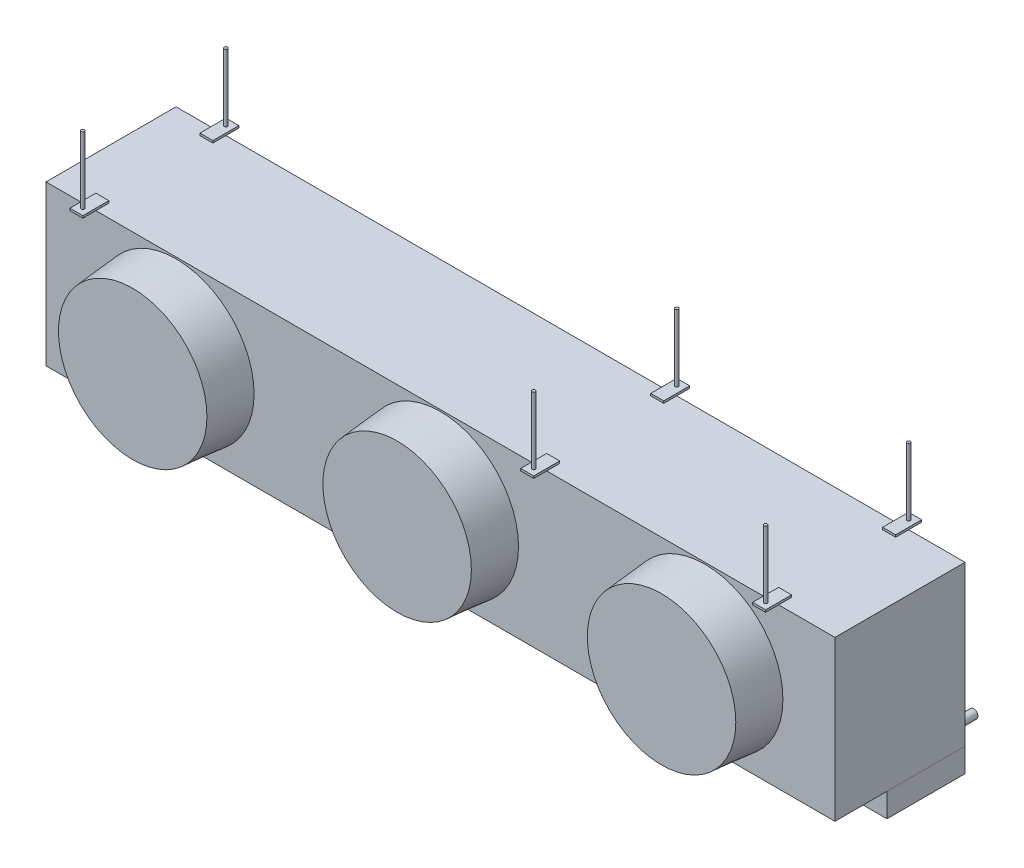
from build123d import *

# Parameters (mm, degrees)
SKETCH1_W                     = 2311.4
SKETCH1_H                     = 381
BOSS_EXTRUDE1_DEPTH           = 466.725
SKETCH2_R                     = 228.6
BOSS_EXTRUDE2_DEPTH           = 127
BOSS_EXTRUDE2_DRAFT           = 5
BOSS_EXTRUDE2_PROFILE_2_DEPTH = 127
BOSS_EXTRUDE2_PROFILE_2_DRAFT = 5
BOSS_EXTRUDE2_PROFILE_3_DEPTH = 127
BOSS_EXTRUDE2_PROFILE_3_DRAFT = 5
SKETCH3_W                     = 38.1
SKETCH3_H                     = 76.2
SKETCH3_R                     = 4.7625
BOSS_EXTRUDE3_DEPTH           = 6.35
SKETCH4_R                     = 4.7625
BOSS_EXTRUDE4_DEPTH           = 203.2
BOSS_EXTRUDE4_2_DEPTH         = 203.2
BOSS_EXTRUDE4_3_DEPTH         = 203.2
BOSS_EXTRUDE4_4_DEPTH         = 203.2
BOSS_EXTRUDE4_5_DEPTH         = 203.2
BOSS_EXTRUDE4_6_DEPTH         = 203.2
SKETCH5_W                     = 2311.4
SKETCH5_H                     = 228.6
BOSS_EXTRUDE5_DEPTH           = 69.85
SKETCH6_R                     = 12.7
SKETCH6_R_2                   = 11.1125
BOSS_EXTRUDE6_DEPTH           = 44.45
SKETCH7_R                     = 12.7
BOSS_EXTRUDE7_DEPTH           = 76.2


with BuildPart() as part:
    # Sketch1 → Boss-Extrude1 (new body)
    with BuildSketch(Plane(origin=(0, 0, 0), x_dir=(1, 0, 0), z_dir=(0, 1, 0))):
        Rectangle(SKETCH1_W, SKETCH1_H)
    extrude(amount=BOSS_EXTRUDE1_DEPTH)


with BuildPart() as boss_extrude2_tool:
    # Sketch2 → Boss-Extrude2 (with draft: the straight prism first)
    with BuildSketch(Plane.XY.offset(190.5)):
        with Locations((0, 233.3625)):
            Circle(SKETCH2_R)
    extrude(amount=BOSS_EXTRUDE2_DEPTH)
    # Boss-Extrude2: the draft: its side faces are tilted about the plane it starts from
    boss_extrude2_sides = [boss_extrude2_tool.faces().sort_by_distance(p)[0] for p in [
        (-228.6, 233.3625, 254),
    ]]
    draft(boss_extrude2_sides, Plane.XY.offset(190.5), BOSS_EXTRUDE2_DRAFT)


with BuildPart() as part_1:
    add(part.part)

    # Boss-Extrude2: add boss_extrude2_tool
    add(boss_extrude2_tool.part)


with BuildPart() as boss_extrude2_profile_2_tool:
    # Sketch2 → Boss-Extrude2 profile 2 (with draft: the straight prism first)
    with BuildSketch(Plane.XY.offset(190.5)):
        with Locations((774.7, 233.3625)):
            Circle(SKETCH2_R)
    extrude(amount=BOSS_EXTRUDE2_PROFILE_2_DEPTH)
    # Boss-Extrude2 profile 2: the draft: its side faces are tilted about the plane it starts from
    boss_extrude2_profile_2_sides = [boss_extrude2_profile_2_tool.faces().sort_by_distance(p)[0] for p in [
        (546.1, 233.3625, 254),
    ]]
    draft(boss_extrude2_profile_2_sides, Plane.XY.offset(190.5), BOSS_EXTRUDE2_PROFILE_2_DRAFT)


with BuildPart() as part_2:
    add(part_1.part)

    # Boss-Extrude2 profile 2: add boss_extrude2_profile_2_tool
    add(boss_extrude2_profile_2_tool.part)


with BuildPart() as boss_extrude2_profile_3_tool:
    # Sketch2 → Boss-Extrude2 profile 3 (with draft: the straight prism first)
    with BuildSketch(Plane.XY.offset(190.5)):
        with Locations((-774.7, 233.3625)):
            Circle(SKETCH2_R)
    extrude(amount=BOSS_EXTRUDE2_PROFILE_3_DEPTH)
    # Boss-Extrude2 profile 3: the draft: its side faces are tilted about the plane it starts from
    boss_extrude2_profile_3_sides = [boss_extrude2_profile_3_tool.faces().sort_by_distance(p)[0] for p in [
        (-1003.3, 233.3625, 254),
    ]]
    draft(boss_extrude2_profile_3_sides, Plane.XY.offset(190.5), BOSS_EXTRUDE2_PROFILE_3_DRAFT)


with BuildPart() as part_3:
    add(part_2.part)

    # Boss-Extrude2 profile 3: add boss_extrude2_profile_3_tool
    add(boss_extrude2_profile_3_tool.part)

    # Sketch3 → Boss-Extrude3 (add)
    # profile 1 of 6: a face of its own
    with BuildSketch(Plane(origin=(0, 466.725, 0), x_dir=(1, 0, 0), z_dir=(0, 1, 0))):
        with Locations((292.1, 190.5)):
            Rectangle(SKETCH3_W, SKETCH3_H)
        with Locations((292.1, 209.55)):
            Circle(SKETCH3_R, mode=Mode.SUBTRACT)
    # profile 2 of 6: a face of its own
    with BuildSketch(Plane(origin=(0, 466.725, 0), x_dir=(1, 0, 0), z_dir=(0, 1, 0))):
        with Locations((292.1, -190.5)):
            Rectangle(SKETCH3_W, SKETCH3_H)
        with Locations((292.1, -209.55)):
            Circle(SKETCH3_R, mode=Mode.SUBTRACT)
    # profile 3 of 6: a face of its own
    with BuildSketch(Plane(origin=(0, 466.725, 0), x_dir=(1, 0, 0), z_dir=(0, 1, 0))):
        with Locations((971.55, 190.5)):
            Rectangle(SKETCH3_W, SKETCH3_H)
        with Locations((971.55, 209.55)):
            Circle(SKETCH3_R, mode=Mode.SUBTRACT)
    # profile 4 of 6: a face of its own
    with BuildSketch(Plane(origin=(0, 466.725, 0), x_dir=(1, 0, 0), z_dir=(0, 1, 0))):
        with Locations((971.55, -190.5)):
            Rectangle(SKETCH3_W, SKETCH3_H)
        with Locations((971.55, -209.55)):
            Circle(SKETCH3_R, mode=Mode.SUBTRACT)
    # profile 5 of 6: a face of its own
    with BuildSketch(Plane(origin=(0, 466.725, 0), x_dir=(1, 0, 0), z_dir=(0, 1, 0))):
        with Locations((-1028.7, 190.5)):
            Rectangle(SKETCH3_W, SKETCH3_H)
        with Locations((-1028.7, 209.55)):
            Circle(SKETCH3_R, mode=Mode.SUBTRACT)
    # profile 6 of 6: a face of its own
    with BuildSketch(Plane(origin=(0, 466.725, 0), x_dir=(1, 0, 0), z_dir=(0, 1, 0))):
        with Locations((-1028.7, -190.5)):
            Rectangle(SKETCH3_W, SKETCH3_H)
        with Locations((-1028.7, -209.55)):
            Circle(SKETCH3_R, mode=Mode.SUBTRACT)
    extrude(amount=BOSS_EXTRUDE3_DEPTH)

    # Sketch7 → Boss-Extrude7 (add)
    with BuildSketch(Plane(origin=(0, 0, -190.5), x_dir=(-1, 0, 0), z_dir=(0, 0, -1))):
        with Locations((-1104.9, 19.05)):
            Circle(SKETCH7_R)
        with Locations((1104.9, 19.05)):
            Circle(SKETCH7_R)
    extrude(amount=BOSS_EXTRUDE7_DEPTH)


with BuildPart() as body_2:
    # Sketch4 → Boss-Extrude4 (new body)
    with BuildSketch(Plane(origin=(0, 466.725, 0), x_dir=(1, 0, 0), z_dir=(0, 1, 0))):
        with Locations((-1028.7, 209.55)):
            Circle(SKETCH4_R)
    extrude(amount=BOSS_EXTRUDE4_DEPTH)


with BuildPart() as body_3:
    # Sketch4 → Boss-Extrude4 2 (new body)
    with BuildSketch(Plane(origin=(0, 466.725, 0), x_dir=(1, 0, 0), z_dir=(0, 1, 0))):
        with Locations((-1028.7, -209.55)):
            Circle(SKETCH4_R)
    extrude(amount=BOSS_EXTRUDE4_2_DEPTH)


with BuildPart() as body_4:
    # Sketch4 → Boss-Extrude4 3 (new body)
    with BuildSketch(Plane(origin=(0, 466.725, 0), x_dir=(1, 0, 0), z_dir=(0, 1, 0))):
        with Locations((292.1, -209.55)):
            Circle(SKETCH4_R)
    extrude(amount=BOSS_EXTRUDE4_3_DEPTH)


with BuildPart() as body_5:
    # Sketch4 → Boss-Extrude4 4 (new body)
    with BuildSketch(Plane(origin=(0, 466.725, 0), x_dir=(1, 0, 0), z_dir=(0, 1, 0))):
        with Locations((292.1, 209.55)):
            Circle(SKETCH4_R)
    extrude(amount=BOSS_EXTRUDE4_4_DEPTH)


with BuildPart() as body_6:
    # Sketch4 → Boss-Extrude4 5 (new body)
    with BuildSketch(Plane(origin=(0, 466.725, 0), x_dir=(1, 0, 0), z_dir=(0, 1, 0))):
        with Locations((971.55, 209.55)):
            Circle(SKETCH4_R)
    extrude(amount=BOSS_EXTRUDE4_5_DEPTH)


with BuildPart() as body_7:
    # Sketch4 → Boss-Extrude4 6 (new body)
    with BuildSketch(Plane(origin=(0, 466.725, 0), x_dir=(1, 0, 0), z_dir=(0, 1, 0))):
        with Locations((971.55, -209.55)):
            Circle(SKETCH4_R)
    extrude(amount=BOSS_EXTRUDE4_6_DEPTH)


with BuildPart() as body_8:
    # Sketch5 → Boss-Extrude5 (new body)
    with BuildSketch(Plane.XZ):
        with Locations((0, -76.2)):
            Rectangle(SKETCH5_W, SKETCH5_H)
    extrude(amount=BOSS_EXTRUDE5_DEPTH)

    # Sketch6 → Boss-Extrude6 (add)
    with BuildSketch(Plane.XZ.offset(69.85)):
        with Locations((0, -76.2)):
            Circle(SKETCH6_R)
        with Locations((0, -76.2)):
            Circle(SKETCH6_R_2, mode=Mode.SUBTRACT)
    extrude(amount=BOSS_EXTRUDE6_DEPTH)


solid = Compound([part_3.part, body_2.part, body_3.part, body_4.part, body_5.part, body_6.part, body_7.part, body_8.part])
